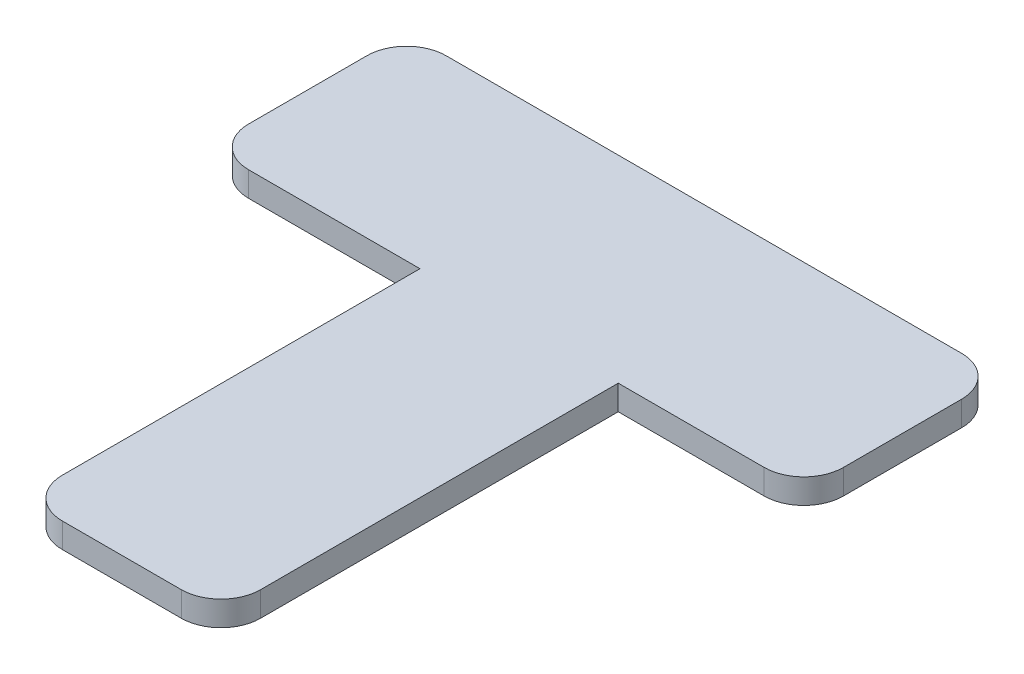
from build123d import *

# Parameters (mm, degrees)
BOSS_EXTRUDE1_DEPTH = 3.175
FILLET1_R           = 5.08


with BuildPart() as part:
    # Sketch1 → Boss-Extrude1 (new body)
    with BuildSketch(Plane(origin=(0, 0, 0), x_dir=(1, 0, 0), z_dir=(0, 1, 0))):
        Polygon((25.4, 50.895849057), (49.170566038, 50.895849057), (49.170566038, 76.2), (-27.029433962, 76.2), (-27.029433962, 50.895849057), (0, 50.895849057), (0, 0), (25.4, 0), align=None)
    extrude(amount=BOSS_EXTRUDE1_DEPTH)

    # Fillet1
    fillet1_edges = [part.edges().sort_by_distance(p)[0] for p in [
        (-27.029433962, 1.5875, -50.895849057),
        (0, 1.5875, 0),
        (25.4, 1.5875, 0),
        (49.170566038, 1.5875, -50.895849057),
        (49.170566038, 1.5875, -76.2),
        (-27.029433962, 1.5875, -76.2),
    ]]
    fillet(fillet1_edges, radius=FILLET1_R)


solid = part.part
